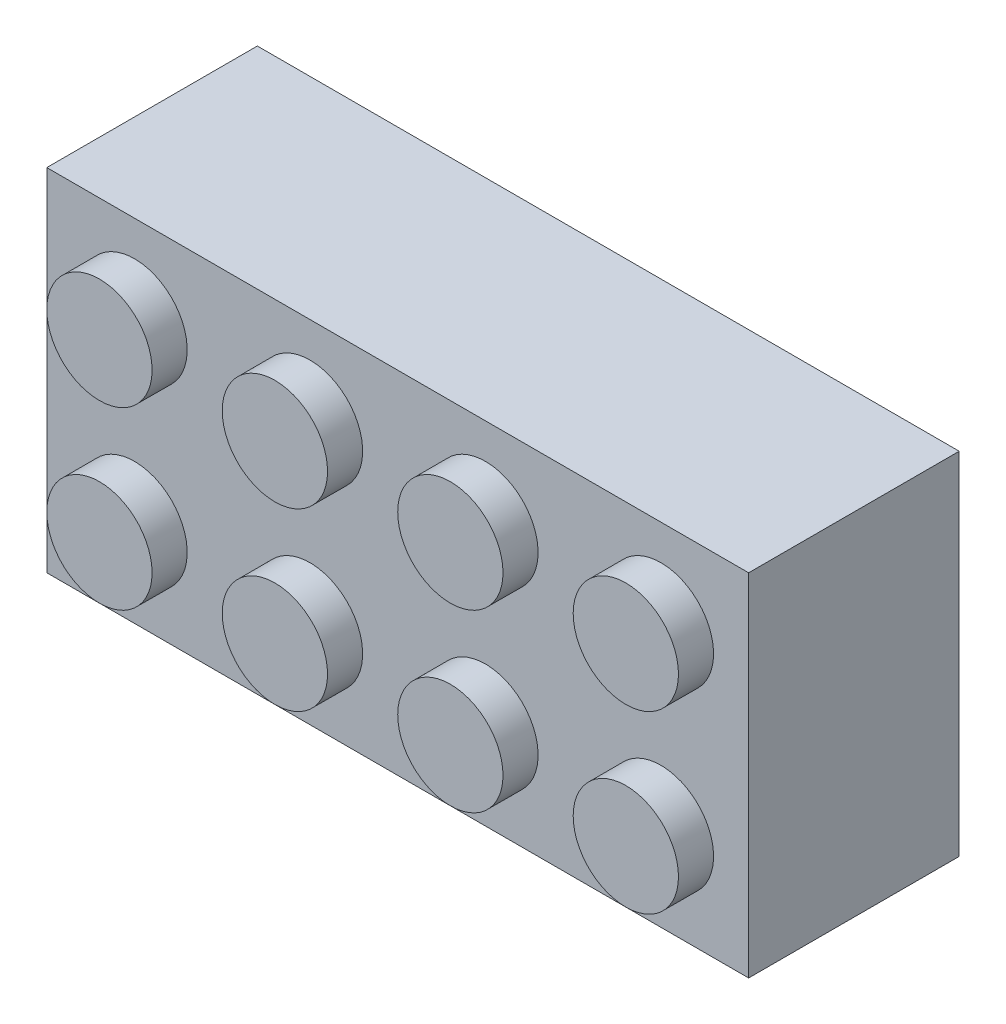
from build123d import *

# Parameters (mm, degrees)
SKETCH1_W              = 31.75
SKETCH1_H              = 15.875
MAIN_BRICK_DEPTH       = 9.525
SKETCH2_R              = 2.38125
PEG_DEPTH              = 1.5875
PEG_PATTERN_COUNT      = 2
PEG_PATTERN_PITCH      = 7.9375
PEG_PATTERN_COUNT_DIR2 = 4
PEG_PATTERN_PITCH_DIR2 = 7.9375
SHELL_BRICK_T          = -1.5875
SKETCH3_R              = 3.175
BOSS_EXTRUDE5_DEPTH    = 7.9375
SHELL9_T               = -0.79375
LPATTERN7_OUTLINE_R    = 3.175
LPATTERN7_OUTLINE_R_2  = 2.38125
LPATTERN7_DEPTH        = 7.9375
LPATTERN7_START        = 7.14375
LPATTERN7_2_OUTLINE_R  = 2.38125
LPATTERN7_2_DEPTH      = 0.79375


# Read off the part's stored shape, not the designer's step: LPattern7
with BuildPart() as part:
    # Sketch1 → Main-Brick (new body)
    with BuildSketch(Plane.XY):
        with Locations((15.875, 7.9375)):
            Rectangle(SKETCH1_W, SKETCH1_H)
    extrude(amount=MAIN_BRICK_DEPTH)

    # Sketch2 → Peg (add)
    with BuildSketch(Plane.XY.offset(9.525)):
        with Locations(Location((3.96875, 11.90625, 0), (0, 0, 180))):
            Circle(SKETCH2_R)
    peg = extrude(amount=PEG_DEPTH)

    # Peg Pattern: Peg 2 × 4
    with Locations(*[(j * PEG_PATTERN_PITCH_DIR2, -i * PEG_PATTERN_PITCH, 0) for i in range(PEG_PATTERN_COUNT) for j in range(PEG_PATTERN_COUNT_DIR2) if (i, j) != (0, 0)]):
        add(peg)

    # Shell-Brick
    shell_brick_openings = [part.faces().sort_by_distance(p)[0] for p in [
        (15.875, 7.9375, 0),
    ]]
    offset(amount=SHELL_BRICK_T, openings=shell_brick_openings, kind=Kind.INTERSECTION)

    # LPattern7 outline → LPattern7 (add)
    # profile 1 of 2: a face of its own
    with BuildSketch(Plane.XY):
        with Locations((15.875, 7.9375)):
            Circle(LPATTERN7_OUTLINE_R)
        with Locations((15.875, 7.9375)):
            Circle(LPATTERN7_OUTLINE_R_2, mode=Mode.SUBTRACT)
    # profile 2 of 2: a face of its own
    with BuildSketch(Plane.XY):
        with Locations((7.9375, 7.9375)):
            Circle(LPATTERN7_OUTLINE_R)
        with Locations((7.9375, 7.9375)):
            Circle(LPATTERN7_OUTLINE_R_2, mode=Mode.SUBTRACT)
    extrude(amount=LPATTERN7_DEPTH)

    # LPattern7 2 outline → LPattern7 2 (add)
    with BuildSketch(Plane.XY.offset(LPATTERN7_START)):
        with Locations((15.875, 7.9375)):
            Circle(LPATTERN7_2_OUTLINE_R)
        with Locations((7.9375, 7.9375)):
            Circle(LPATTERN7_2_OUTLINE_R)
    extrude(amount=LPATTERN7_2_DEPTH)


with BuildPart() as body_2:
    # Sketch3 → Boss-Extrude5 (new body)
    with BuildSketch(Plane(origin=(0, 0, 7.9375), x_dir=(-1, 0, 0), z_dir=(0, 0, -1))):
        with Locations((-23.8125, 7.9375)):
            Circle(SKETCH3_R)
    extrude(amount=BOSS_EXTRUDE5_DEPTH)

    # Shell9
    shell9_openings = [body_2.faces().sort_by_distance(p)[0] for p in [
        (23.8125, 7.9375, 0),
    ]]
    offset(amount=SHELL9_T, openings=shell9_openings, kind=Kind.INTERSECTION)


solid = Compound([part.part, body_2.part])
